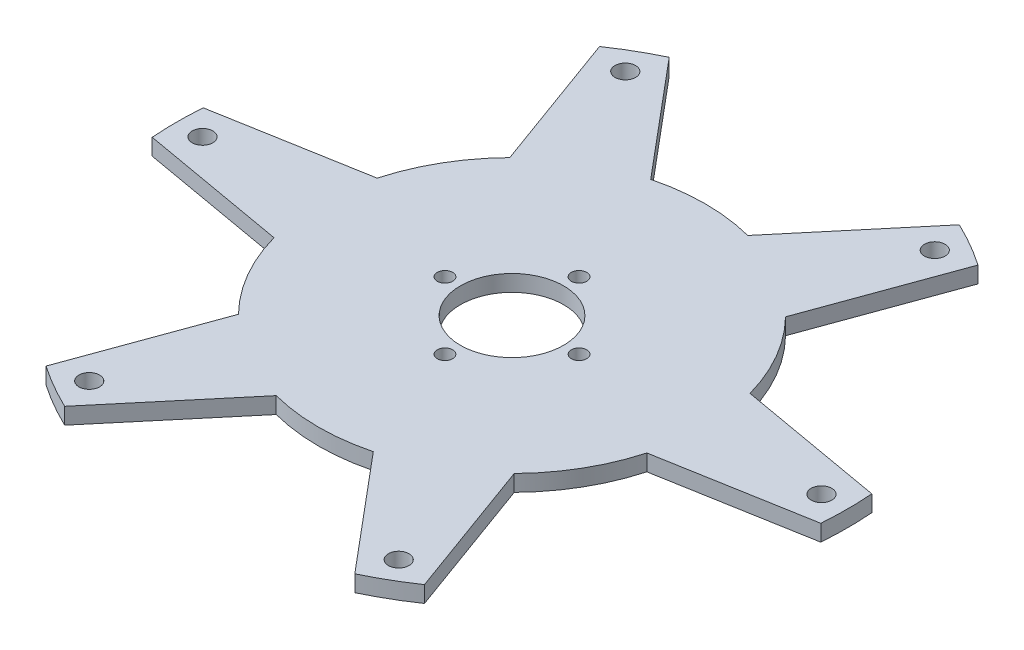
from build123d import *

# Parameters (mm, degrees)
SKETCH2_R           = 10
SKETCH2_R_2         = 1.5
SKETCH2_R_3         = 2
BOSS_EXTRUDE1_DEPTH = 3.175


with BuildPart() as part:
    # Sketch2 → Boss-Extrude1 (new body)
    with BuildSketch(Plane(origin=(0, 0, 0), x_dir=(1, 0, 0), z_dir=(0, 1, 0))):
        with BuildLine():
            Line((-36.142080737, 10), (-64.81164344, 4.94478257))
            ThreePointArc((-64.81164344, 4.94478257), (-65, 0), (-64.81164344, -4.94478257))
            Line((-64.81164344, -4.94478257), (-36.142080737, -10))
            ThreePointArc((-36.142080737, -10), (-32.475952642, -18.75), (-26.731294406, -26.299960064))
            Line((-26.731294406, -26.299960064), (-36.688129042, -53.656138394))
            ThreePointArc((-36.688129042, -53.656138394), (-32.5, -56.291651246), (-28.123514398, -58.600920965))
            Line((-28.123514398, -58.600920965), (-9.410786331, -36.299960064))
            ThreePointArc((-9.410786331, -36.299960064), (0, -37.5), (9.410786331, -36.299960064))
            Line((9.410786331, -36.299960064), (28.123514398, -58.600920965))
            ThreePointArc((28.123514398, -58.600920965), (32.5, -56.291651246), (36.688129042, -53.656138394))
            Line((36.688129042, -53.656138394), (26.731294406, -26.299960064))
            ThreePointArc((26.731294406, -26.299960064), (32.475952642, -18.75), (36.142080737, -10))
            Line((36.142080737, -10), (64.81164344, -4.94478257))
            ThreePointArc((64.81164344, -4.94478257), (65, 0), (64.81164344, 4.94478257))
            Line((64.81164344, 4.94478257), (36.142080737, 10))
            ThreePointArc((36.142080737, 10), (32.475952642, 18.75), (26.731294406, 26.299960064))
            Line((26.731294406, 26.299960064), (36.688129042, 53.656138394))
            ThreePointArc((36.688129042, 53.656138394), (32.5, 56.291651246), (28.123514398, 58.600920965))
            Line((28.123514398, 58.600920965), (9.410786331, 36.299960064))
            ThreePointArc((9.410786331, 36.299960064), (0, 37.5), (-9.410786331, 36.299960064))
            Line((-9.410786331, 36.299960064), (-28.123514398, 58.600920965))
            ThreePointArc((-28.123514398, 58.600920965), (-32.5, 56.291651246), (-36.688129042, 53.656138394))
            Line((-36.688129042, 53.656138394), (-26.731294406, 26.299960064))
            ThreePointArc((-26.731294406, 26.299960064), (-32.475952642, 18.75), (-36.142080737, 10))
        make_face()
        Circle(SKETCH2_R, mode=Mode.SUBTRACT)
        with Locations((0, 13)):
            Circle(SKETCH2_R_2, mode=Mode.SUBTRACT)
        with Locations((13, 0)):
            Circle(SKETCH2_R_2, mode=Mode.SUBTRACT)
        with Locations((0, -13)):
            Circle(SKETCH2_R_2, mode=Mode.SUBTRACT)
        with Locations((-13, 0)):
            Circle(SKETCH2_R_2, mode=Mode.SUBTRACT)
        with Locations((-60, 0)):
            Circle(SKETCH2_R_3, mode=Mode.SUBTRACT)
        with Locations((-30, 51.961524227)):
            Circle(SKETCH2_R_3, mode=Mode.SUBTRACT)
        with Locations((30, 51.961524227)):
            Circle(SKETCH2_R_3, mode=Mode.SUBTRACT)
        with Locations((60, 0)):
            Circle(SKETCH2_R_3, mode=Mode.SUBTRACT)
        with Locations((30, -51.961524227)):
            Circle(SKETCH2_R_3, mode=Mode.SUBTRACT)
        with Locations((-30, -51.961524227)):
            Circle(SKETCH2_R_3, mode=Mode.SUBTRACT)
    extrude(amount=BOSS_EXTRUDE1_DEPTH)


solid = part.part
